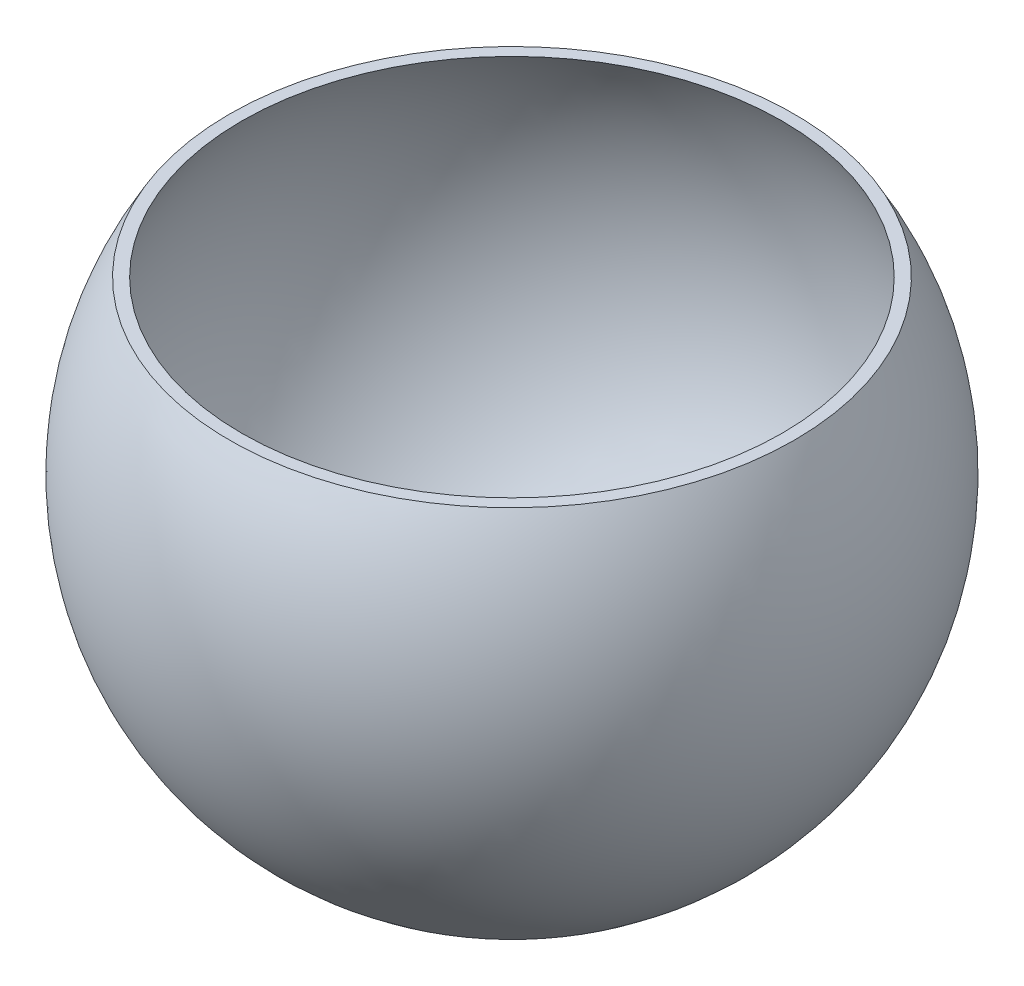
from build123d import *


with BuildPart() as part:
    # Sketch1 → Revolve1 (revolve)
    with BuildSketch(Plane.XY):
        with BuildLine():
            Line((174.101233777, 194.668503093), (166.646098372, 194.668503093))
            ThreePointArc((166.646098372, 194.668503093), (172.302072359, -5.306331078), (0, -106.962222222))
            Line((0, -106.962222222), (0, -113.312222222))
            ThreePointArc((0, -113.312222222), (176.892175327, -10.109213717), (174.101233777, 194.668503093))
        make_face()
    revolve(axis=Axis((0, 0, 0), (0, -1, 0)))


solid = part.part
